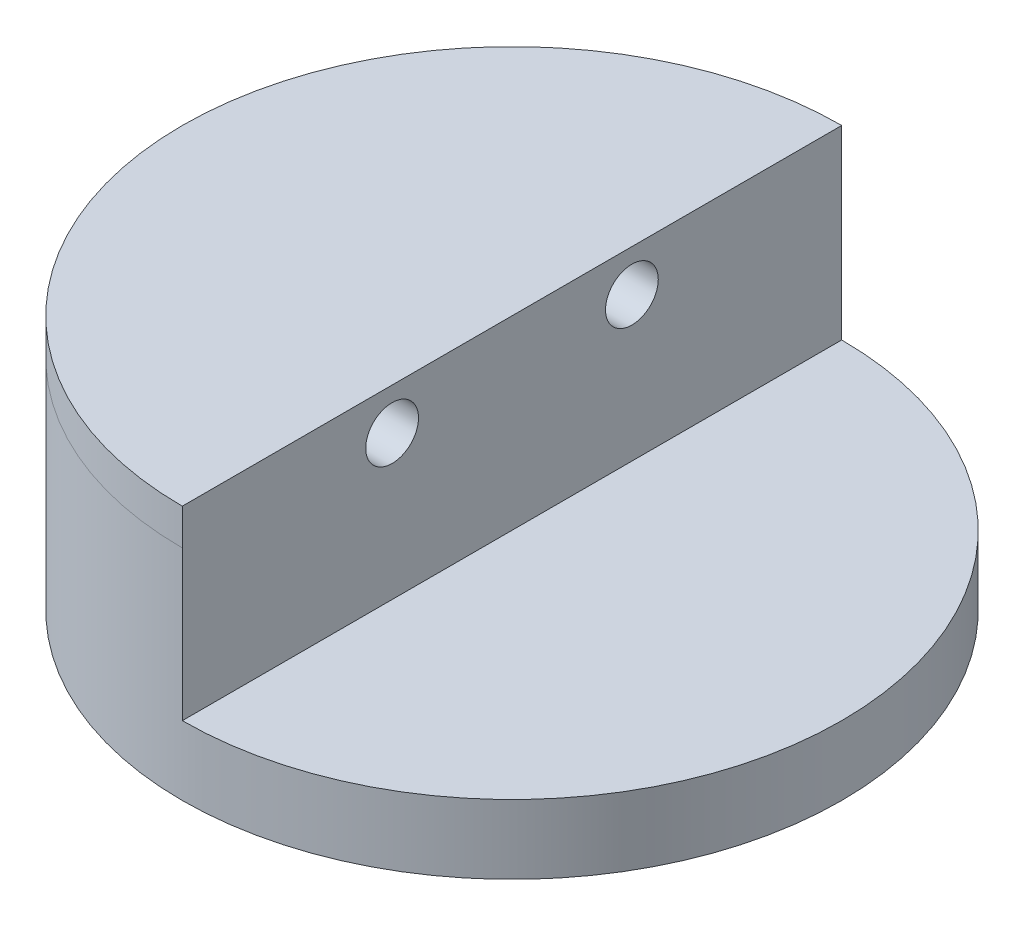
from build123d import *

# Parameters (mm, degrees)
SCHIZZO1_R                      = 55
ESTRUSIONE_ESTRUSIONE1_DEPTH    = 35
SCHIZZO2_R                      = 28
TAGLIO_ESTRUSIONE1_DEPTH        = 10
SWEEP1_START                    = 35
SWEEP1_OUTLINE_R                = 55
SWEEP1_DEPTH                    = 7.529292994
SCHIZZO10_W                     = 110
SCHIZZO10_H                     = 30.991723426
TAGLIO_ESTRUSIONE3_DEPTH        = 70
FORO_FILETTATO_M10X1_25_1_D     = 8.8
FORO_FILETTATO_M10X1_25_1_DEPTH = 26.25
FORO_FILETTATO_M10X1_25_1_TIP   = 2.643786724


# Read off the part's stored shape, not the designer's step: Sweep1
with BuildPart() as part:
    # Schizzo1 → Estrusione-Estrusione1 (new body)
    with BuildSketch(Plane(origin=(0, 0, 0), x_dir=(1, 0, 0), z_dir=(0, 1, 0))):
        with Locations(Location((0, 0, 0), (0, 0, 270))):
            Circle(SCHIZZO1_R)
    extrude(amount=ESTRUSIONE_ESTRUSIONE1_DEPTH)

    # Schizzo2 → Taglio-Estrusione1 (cut)
    with BuildSketch(Plane(origin=(0, 0, 0), x_dir=(-1, 0, 0), z_dir=(0, -1, 0))):
        with Locations(Location((0, 0, 0), (0, 0, 90))):
            Circle(SCHIZZO2_R)
    extrude(amount=-TAGLIO_ESTRUSIONE1_DEPTH, mode=Mode.SUBTRACT)

    # Sweep1 outline → Sweep1 (add)
    with BuildSketch(Plane(origin=(0, 0, 0), x_dir=(1, 0, 0), z_dir=(0, 1, 0)).offset(SWEEP1_START)):
        Circle(SWEEP1_OUTLINE_R)
    extrude(amount=SWEEP1_DEPTH)

    # Schizzo10 → Taglio-Estrusione3 (cut)
    with BuildSketch(Plane(origin=(0, 0, 0), x_dir=(0, 0, -1), z_dir=(1, 0, 0))):
        with Locations((0, 27.033431281)):
            Rectangle(SCHIZZO10_W, SCHIZZO10_H)
    extrude(amount=TAGLIO_ESTRUSIONE3_DEPTH, mode=Mode.SUBTRACT)

    # Foro filettato M10x1.25-1
    with Locations(Plane(origin=(0, 0, 0), x_dir=(0, 0, -1), z_dir=(1, 0, 0))):
        with Locations((-20, 35.589292994), (20, 35.589292994)):
            Hole(FORO_FILETTATO_M10X1_25_1_D / 2, depth=FORO_FILETTATO_M10X1_25_1_DEPTH)
            with Locations((0, 0, -(FORO_FILETTATO_M10X1_25_1_DEPTH + FORO_FILETTATO_M10X1_25_1_TIP / 2))):  # 118° drill point
                Cone(0, FORO_FILETTATO_M10X1_25_1_D / 2, FORO_FILETTATO_M10X1_25_1_TIP, mode=Mode.SUBTRACT)


solid = part.part
